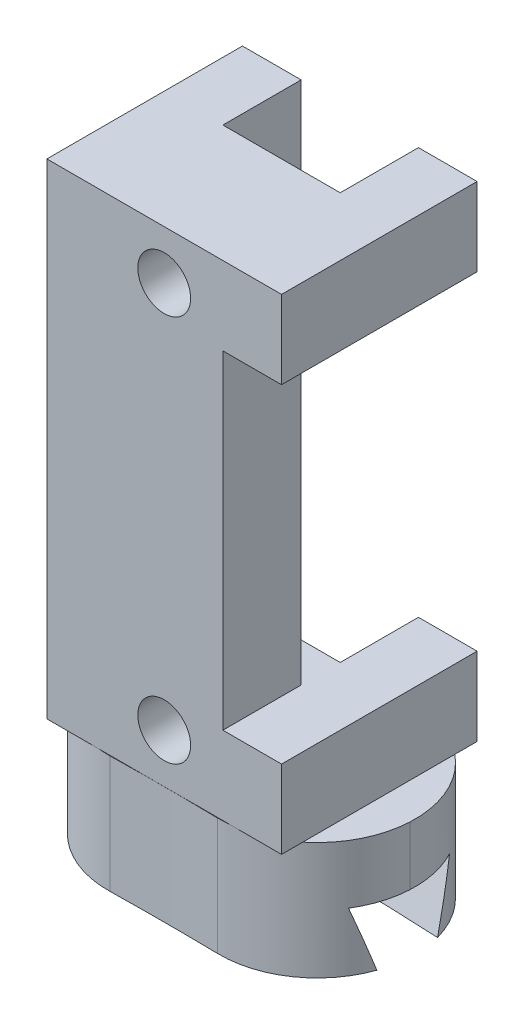
from build123d import *

# Parameters (mm, degrees)
SKETCH7_W          = 12
SKETCH7_H          = 24.8
MAIN_DEPTH         = 5
SKETCH8_R          = 1.35
HOLES_DEPTH        = 28.405109013
SKETCH16_W         = 6
SKETCH16_H         = 16.8
FIXEXTRUSION_DEPTH = 158.429476274
SUPPORT_ANGLE      = 6
FILLET1_R          = 5
SKETCH17_W         = 6
SKETCH17_H         = 24.8
CUT_EXTRUDE1_DEPTH = 4
SKETCH18_W         = 3
SKETCH18_H         = 16.8
CUT_EXTRUDE2_DEPTH = 27.696588907


with BuildPart() as part:
    # Sketch7 → Main (new, symmetric)
    with BuildSketch(Plane.XY.offset(-150)):
        with Locations((0, 12.4)):
            Rectangle(SKETCH7_W, SKETCH7_H)
    extrude(amount=MAIN_DEPTH, both=True)

    # Sketch8 → Holes (cut, through all)
    with BuildSketch(Plane.XY.offset(-145)):
        with Locations((0, 22.3)):
            Circle(SKETCH8_R)
        with Locations((0, 2.5)):
            Circle(SKETCH8_R)
    extrude(amount=-HOLES_DEPTH, mode=Mode.SUBTRACT)

    # Sketch16 → FixExtrusion (cut, through all)
    with BuildSketch(Plane(origin=(6, 0, 0), x_dir=(0, 0, -1), z_dir=(1, 0, 0))):
        with Locations((152, 12.4)):
            Rectangle(SKETCH16_W, SKETCH16_H)
    extrude(amount=-FIXEXTRUSION_DEPTH, mode=Mode.SUBTRACT)

    # Sketch17 → Cut-Extrude1 (cut)
    with BuildSketch(Plane(origin=(0, 0, -155), x_dir=(-1, 0, 0), z_dir=(0, 0, -1))):
        with Locations((0, 12.4)):
            Rectangle(SKETCH17_W, SKETCH17_H)
    extrude(amount=-CUT_EXTRUDE1_DEPTH, mode=Mode.SUBTRACT)

    # Sketch18 → Cut-Extrude2 (cut, through all)
    with BuildSketch(Plane(origin=(0, 0, -149), x_dir=(-1, 0, 0), z_dir=(0, 0, -1))):
        with Locations((-4.5, 12.4)):
            Rectangle(SKETCH18_W, SKETCH18_H)
    extrude(amount=-CUT_EXTRUDE2_DEPTH, mode=Mode.SUBTRACT)


with BuildPart() as body_2:
    # Sketch10 → Support (revolve, symmetric)
    with BuildSketch(Plane(origin=(0, 0, 0), x_dir=(0, 0, -1), z_dir=(1, 0, 0))) as support_sk:
        Polygon((152.5, -3), (147.5, -3), (148.5, -6), (145, -6), (145, 0), (155, 0), (155, -6), (151.5, -6), align=None)
    revolve(axis=Axis((0, 11, 0), (0, -1, 0)), revolution_arc=SUPPORT_ANGLE / 2)
    revolve(support_sk.sketch, axis=Axis((0, 11, 0), (0, 1, 0)), revolution_arc=SUPPORT_ANGLE / 2)

    # Fillet1
    fillet1_edges = [body_2.edges().sort_by_distance(p)[0] for p in [
        (8.112073218, -3, -154.787577887),
        (-8.112073218, -3, -154.787577887),
        (7.588713655, -3, -144.801282539),
        (-7.588713655, -3, -144.801282539),
    ]]
    fillet(fillet1_edges, radius=FILLET1_R - 0.0001)  # a hair under: the kernel refuses the full size


solid = Compound([part.part, body_2.part])
